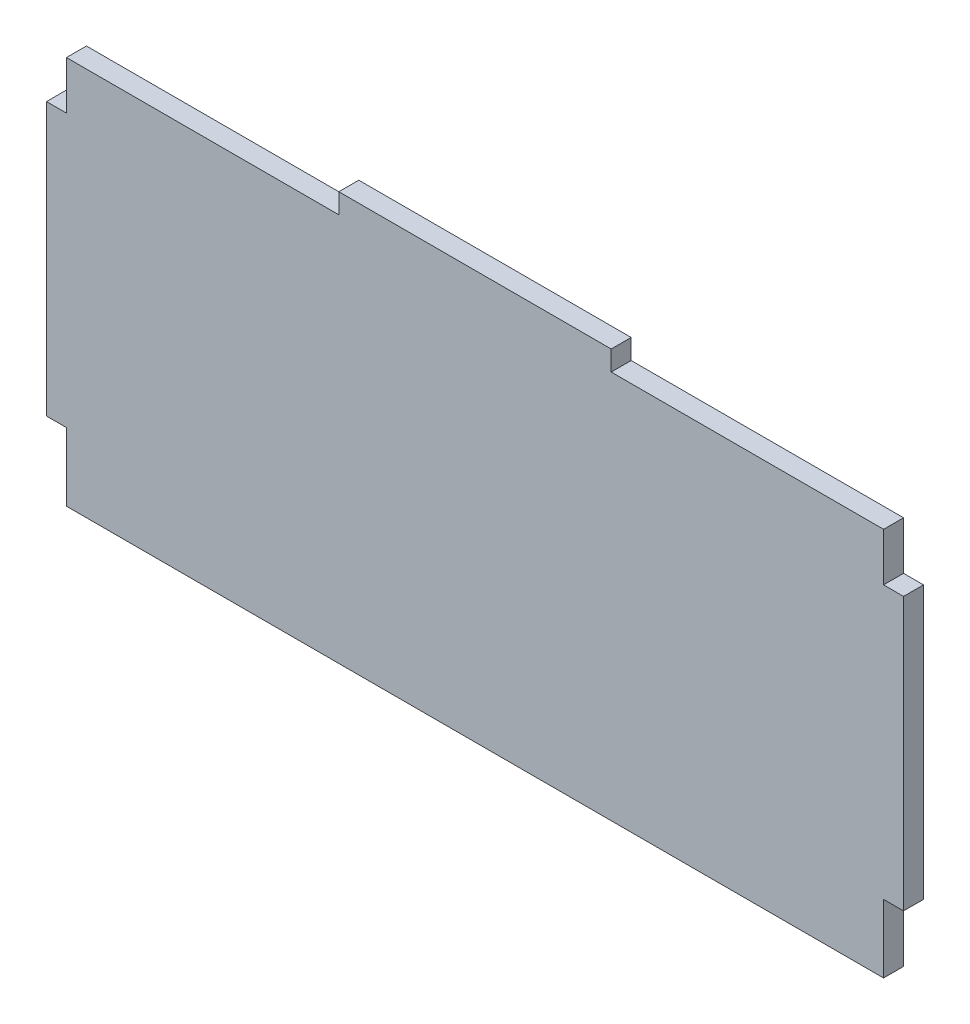
from build123d import *

# Parameters (mm, degrees)
BOSS_EXTRUDE1_DEPTH = 5.588


with BuildPart() as part:
    # Sketch1 → Boss-Extrude1 (new body)
    with BuildSketch(Plane.XY):
        Polygon((26.633678216, 19.051893638), (-49.566321784, 19.051893638), (-49.566321784, 5.589893638), (-55.154321784, 5.589893638), (-55.154321784, -70.610106362), (-49.566321784, -70.610106362), (-49.566321784, -89.660106362), (179.033678216, -89.660106362), (179.033678216, -70.610106362), (184.621678216, -70.610106362), (184.621678216, 5.589893638), (179.033678216, 5.589893638), (179.033678216, 19.051893638), (102.833678216, 19.051893638), (102.833678216, 24.639893638), (26.633678216, 24.639893638), align=None)
    extrude(amount=BOSS_EXTRUDE1_DEPTH)


solid = part.part
